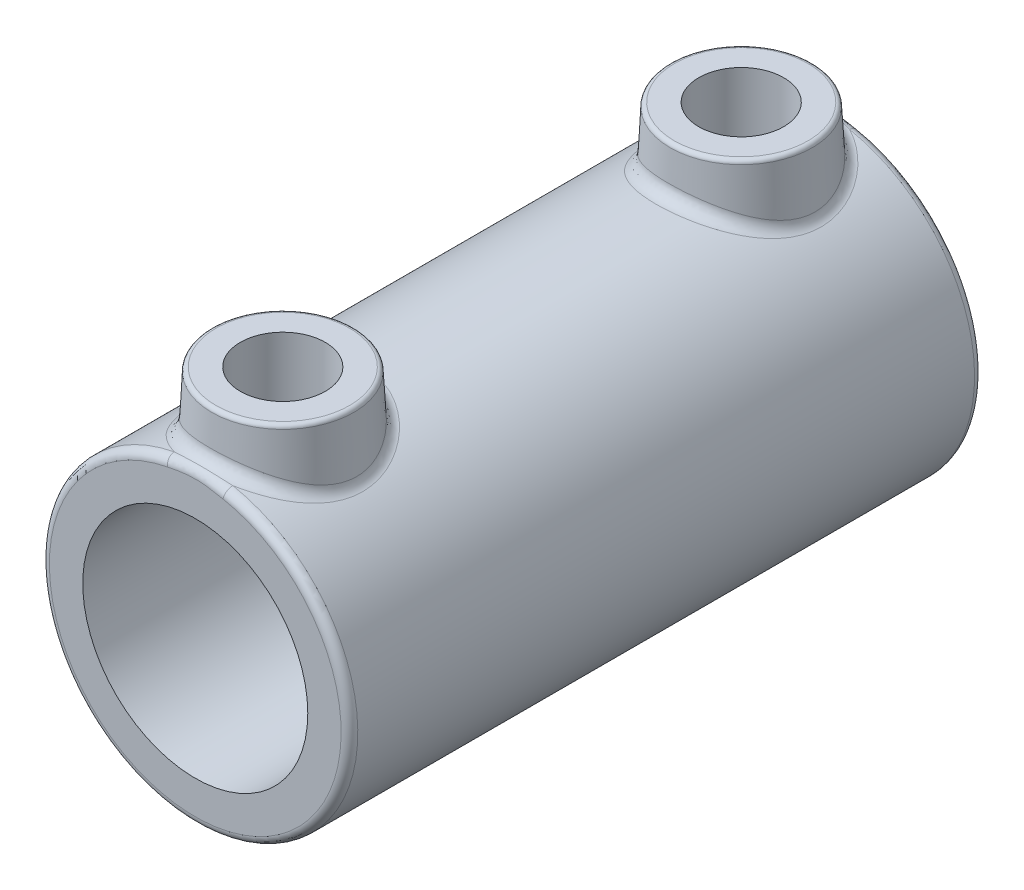
from build123d import *

# Parameters (mm, degrees)
ESQUISSE1_R             = 18.5
ESQUISSE1_R_2           = 13.5
EXTRUSION1_DEPTH        = 76
EXTRUSION2_OUTLINE_R    = 8.5
EXTRUSION2_DEPTH        = 7.785907855
EXTRUSION2_DRAFT        = 3
EXTRUSION2_2_OUTLINE_R  = 8.5
EXTRUSION2_2_DEPTH      = 7.785907855
EXTRUSION2_2_DRAFT      = 3
CONG_1_R                = 0.5
CONG_2_R                = 1.5
TROU_TARAUD_M121_REACH  = 91.02
TROU_TARAUD_M121_BORE_R = 5.1
CONG_3_R                = 1


# Read off the part's stored shape, not the designer's step: Extrusion2
with BuildPart() as part:
    # Esquisse1 → Extrusion1 (new body)
    with BuildSketch(Plane.XY):
        Circle(ESQUISSE1_R)
        Circle(ESQUISSE1_R_2, mode=Mode.SUBTRACT)
    extrude(amount=EXTRUSION1_DEPTH)


with BuildPart() as extrusion2_tool:
    # Extrusion2 outline → Extrusion2 (with draft: the straight prism first)
    with BuildSketch(Plane(origin=(0, 24, 0), x_dir=(-1, 0, 0), z_dir=(0, 1, 0))):
        with Locations((0, 10.5)):
            Circle(EXTRUSION2_OUTLINE_R)
    extrude(amount=-EXTRUSION2_DEPTH)
    # Extrusion2: the draft: its side faces are tilted about the plane it starts from
    extrusion2_sides = [extrusion2_tool.faces().sort_by_distance(p)[0] for p in [
        (8.5, 20.107046073, 10.5),
    ]]
    draft(extrusion2_sides, Plane(origin=(0, 24, 0), x_dir=(-1, 0, 0), z_dir=(0, 1, 0)), EXTRUSION2_DRAFT)


with BuildPart() as part_1:
    add(part.part)

    # Extrusion2: add extrusion2_tool
    add(extrusion2_tool.part)


with BuildPart() as extrusion2_2_tool:
    # Extrusion2 2 outline → Extrusion2 2 (with draft: the straight prism first)
    with BuildSketch(Plane(origin=(0, 24, 0), x_dir=(-1, 0, 0), z_dir=(0, 1, 0))):
        with Locations((0, 65.5)):
            Circle(EXTRUSION2_2_OUTLINE_R)
    extrude(amount=-EXTRUSION2_2_DEPTH)
    # Extrusion2 2: the draft: its side faces are tilted about the plane it starts from
    extrusion2_2_sides = [extrusion2_2_tool.faces().sort_by_distance(p)[0] for p in [
        (8.5, 20.107046073, 65.5),
    ]]
    draft(extrusion2_2_sides, Plane(origin=(0, 24, 0), x_dir=(-1, 0, 0), z_dir=(0, 1, 0)), EXTRUSION2_2_DRAFT)


with BuildPart() as part_2:
    add(part_1.part)

    # Extrusion2 2: add extrusion2_2_tool
    add(extrusion2_2_tool.part)

    # Congé1
    cong_1_edges = [part_2.edges().sort_by_distance(p)[0] for p in [
        (8.5, 24, 10.5),
        (8.5, 24, 65.5),
    ]]
    fillet(cong_1_edges, radius=CONG_1_R)

    # Congé2
    cong_2_edges = [part_2.edges().sort_by_distance(p)[0] for p in [
        (8.908042138, 16.214092181, 10.5),
        (8.908042138, 16.214092181, 65.5),
    ]]
    fillet(cong_2_edges, radius=CONG_2_R)

    # Trou taraudé M121 bore → Trou taraudé M121 (cut, up to next)
    with BuildSketch(Plane(origin=(0, 24, 0), x_dir=(-1, 0, 0), z_dir=(0, 1, 0)), mode=Mode.PRIVATE) as trou_taraud_m121_sk1:
        with Locations((0, 65.5)):
            Circle(TROU_TARAUD_M121_BORE_R)
    trou_taraud_m121_tool1 = extrude(trou_taraud_m121_sk1.sketch, amount=-TROU_TARAUD_M121_REACH, mode=Mode.PRIVATE) & part_2.part
    # Trou taraudé M121 bore → Trou taraudé M121 (cut, up to next)
    with BuildSketch(Plane(origin=(0, 24, 0), x_dir=(-1, 0, 0), z_dir=(0, 1, 0)), mode=Mode.PRIVATE) as trou_taraud_m121_sk2:
        with Locations((0, 10.5)):
            Circle(TROU_TARAUD_M121_BORE_R)
    trou_taraud_m121_tool2 = extrude(trou_taraud_m121_sk2.sketch, amount=-TROU_TARAUD_M121_REACH, mode=Mode.PRIVATE) & part_2.part
    add(trou_taraud_m121_tool1.solids().sort_by_distance((0, 24, 65.5))[0], mode=Mode.SUBTRACT)
    add(trou_taraud_m121_tool2.solids().sort_by_distance((0, 24, 10.5))[0], mode=Mode.SUBTRACT)

    # Congé3
    cong_3_edges = [part_2.edges().sort_by_distance(p)[0] for p in [
        (-18.5, 0, 76),
        (-18.5, 0, 0),
    ]]
    fillet(cong_3_edges, radius=CONG_3_R)


solid = part_2.part
